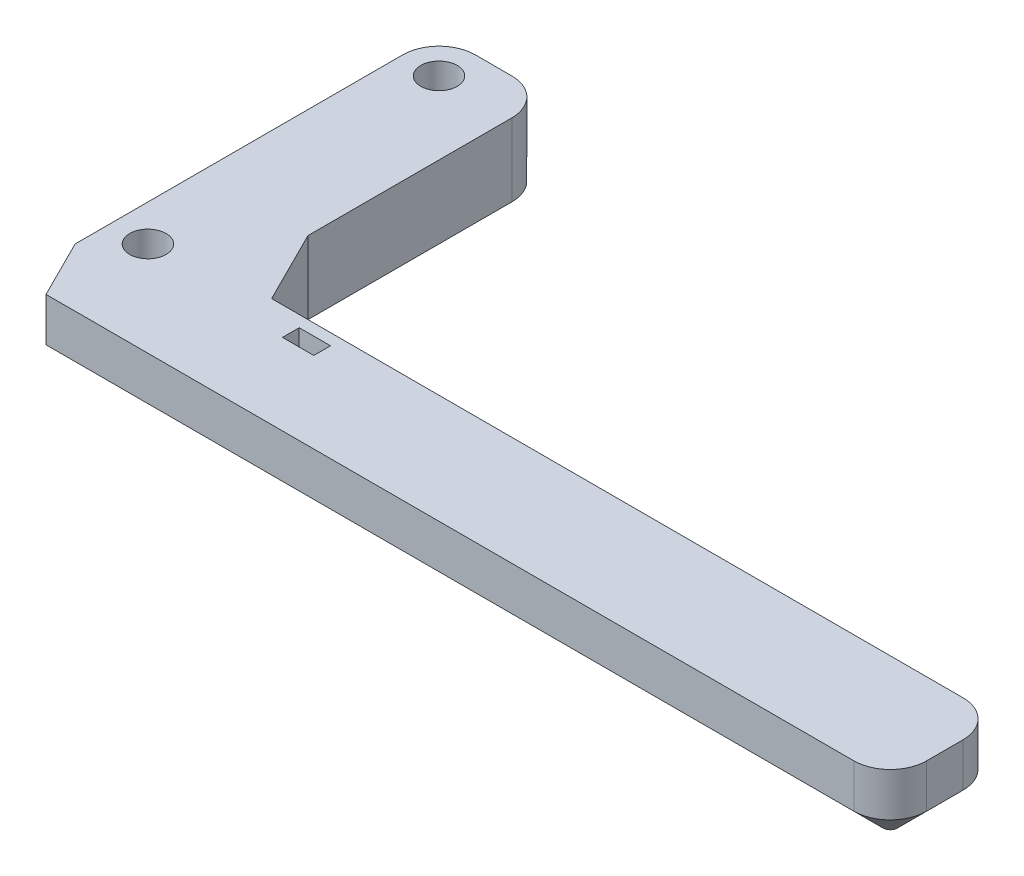
from build123d import *

# Parameters (mm, degrees)
SKETCH1_R           = 2.5
SKETCH1_W           = 4.3
SKETCH1_H           = 2.3
BOSS_EXTRUDE1_DEPTH = 10
SKETCH2_W           = 4
SKETCH2_H           = 59.39567842
CUT_EXTRUDE1_DEPTH  = 3
FILLET3_R           = 5
CHAMFER2_SIZE       = 4


with BuildPart() as part:
    # Sketch1 → Boss-Extrude1 (new body)
    with BuildSketch(Plane(origin=(0, 0, 0), x_dir=(1, 0, 0), z_dir=(0, 1, 0))):
        Polygon((0, -25), (0, 25), (15, 25), (15, -8), (20, -18), (32, -18), (35, -18), (120, -18), (120, -33), (4, -33), align=None)
        with Locations(Location((5, 20, 0), (0, 0, 270))):
            Circle(SKETCH1_R, mode=Mode.SUBTRACT)
        with Locations(Location((5, -20, 0), (0, 0, 270))):
            Circle(SKETCH1_R, mode=Mode.SUBTRACT)
        with Locations((27.51, -20.72)):
            Rectangle(SKETCH1_W, SKETCH1_H, mode=Mode.SUBTRACT)
    extrude(amount=BOSS_EXTRUDE1_DEPTH)

    # Sketch2 → Cut-Extrude1 (cut)
    with BuildSketch(Plane.XZ):
        with Locations((12, 4.69783921)):
            Rectangle(SKETCH2_W, SKETCH2_H)
    extrude(amount=-CUT_EXTRUDE1_DEPTH, mode=Mode.SUBTRACT)

    # Fillet3
    fillet3_edges = [part.edges().sort_by_distance(p)[0] for p in [
        (120, 5, 33),
        (120, 5, 18),
        (0, 5, -25),
        (15, 5, -25),
    ]]
    fillet(fillet3_edges, radius=FILLET3_R)

    # Chamfer2
    # the kernel refuses this chamfer: 4 mm, written as the material it takes off along each edge
    with BuildSketch(Plane(origin=(20.286731952, 0, 33), x_dir=(0, -0.027495876610586365, -0.9996219169112968), z_dir=(-1, 0, 0))) as chamfer2_piece_1:
        Polygon((CHAMFER2_SIZE * 0.999621916911, -CHAMFER2_SIZE * 0.0274958766106), (-CHAMFER2_SIZE * 0.0274958766106, -CHAMFER2_SIZE * 0.999621916911), (0, 0), align=None)
    extrude(amount=26.573463904, mode=Mode.SUBTRACT)
    with BuildSketch(Plane(origin=(115, 0, 33), x_dir=(0, 0.9996219169112968, 0.02749587661058563), z_dir=(-1, 0, 0))) as chamfer2_piece_2:
        Polygon((CHAMFER2_SIZE * 0.999621916911, CHAMFER2_SIZE * 0.0274958766106), (-CHAMFER2_SIZE * 0.0274958766106, CHAMFER2_SIZE * 0.999621916911), (0, 0), align=None)
    extrude(amount=111.286731952, mode=Mode.SUBTRACT)
    with BuildSketch(Plane(origin=(120, 0, 23), x_dir=(0.02749587661058563, 0.9996219169112968, 0), z_dir=(0, 0, 1))) as chamfer2_piece_3:
        Polygon((CHAMFER2_SIZE * 0.999621916911, CHAMFER2_SIZE * 0.0274958766106), (-CHAMFER2_SIZE * 0.0274958766106, CHAMFER2_SIZE * 0.999621916911), (0, 0), align=None)
    extrude(amount=5, mode=Mode.SUBTRACT)
    with BuildSketch(Plane(origin=(115, 0, 18), x_dir=(0, 0.999621916911297, -0.02749587661058045), z_dir=(-1, 0, 0))) as chamfer2_piece_4_section:
        Polygon((CHAMFER2_SIZE * 0.999621916911, -CHAMFER2_SIZE * 0.0274958766106), (-CHAMFER2_SIZE * 0.0274958766106, -CHAMFER2_SIZE * 0.999621916911), (0, 0), align=None)
    chamfer2_piece_4 = extrude(amount=105.286731952, mode=Mode.PRIVATE)
    chamfer2_piece_4 = split(chamfer2_piece_4, bisect_by=Plane(origin=(30.091205291, 1.322053336, 38.182410583), z_dir=(0.8944271909999159, 0, -0.4472135954999581)), keep=Keep.TOP, mode=Mode.PRIVATE)
    add(chamfer2_piece_4, mode=Mode.SUBTRACT)
    with BuildSketch(Plane(origin=(115, 0, 23), x_dir=(0, 0, -1), z_dir=(-1, 0, 0))) as chamfer2_piece_5:
        Polygon((5, -CHAMFER2_SIZE), (5 - CHAMFER2_SIZE, 0), (5, 0), align=None)
    revolve(axis=Axis((115, 0, 23), (0, -1, 0)), revolution_arc=90, mode=Mode.SUBTRACT)
    with BuildSketch(Plane(origin=(115, 0, 28), x_dir=(0, 0, 1), z_dir=(-1, 0, 0))) as chamfer2_piece_6:
        Polygon((5, CHAMFER2_SIZE), (5 - CHAMFER2_SIZE, 0), (5, 0), align=None)
    revolve(axis=Axis((115, 0, 28), (0, 1, 0)), revolution_arc=90, mode=Mode.SUBTRACT)


solid = part.part
